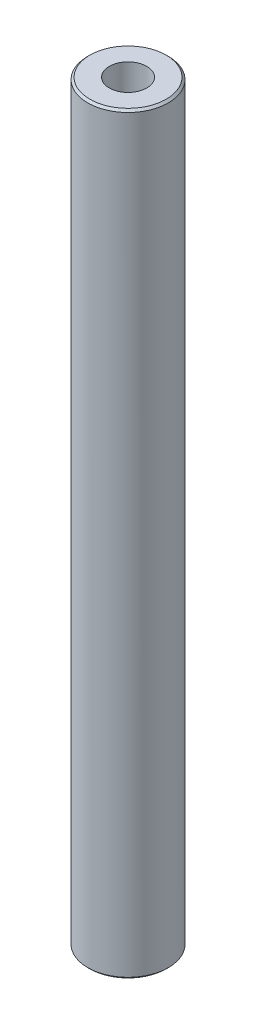
from build123d import *

# Parameters (mm, degrees)
SKETCH1_R           = 7.5
BOSS_EXTRUDE1_DEPTH = 140.096401735
SKETCH2_R           = 3.48943912
CUT_EXTRUDE1_DEPTH  = 141.497337267
CHAMFER1_SIZE       = 0.394173759


with BuildPart() as part:
    # Sketch1 → Boss-Extrude1 (new body)
    with BuildSketch(Plane(origin=(0, 0, 0), x_dir=(1, 0, 0), z_dir=(0, 1, 0))):
        Circle(SKETCH1_R)
    extrude(amount=BOSS_EXTRUDE1_DEPTH)

    # Sketch2 → Cut-Extrude1 (cut, through all)
    with BuildSketch(Plane(origin=(0, 0, 0), x_dir=(1, 0, 0), z_dir=(0, 1, 0))):
        Circle(SKETCH2_R)
    extrude(amount=CUT_EXTRUDE1_DEPTH, mode=Mode.SUBTRACT)

    # Chamfer1
    chamfer1_edges = [part.edges().sort_by_distance(p)[0] for p in [
        (-7.5, 140.096401735, 0),
        (-7.5, 0, 0),
    ]]
    chamfer(chamfer1_edges, length=CHAMFER1_SIZE)


solid = part.part
